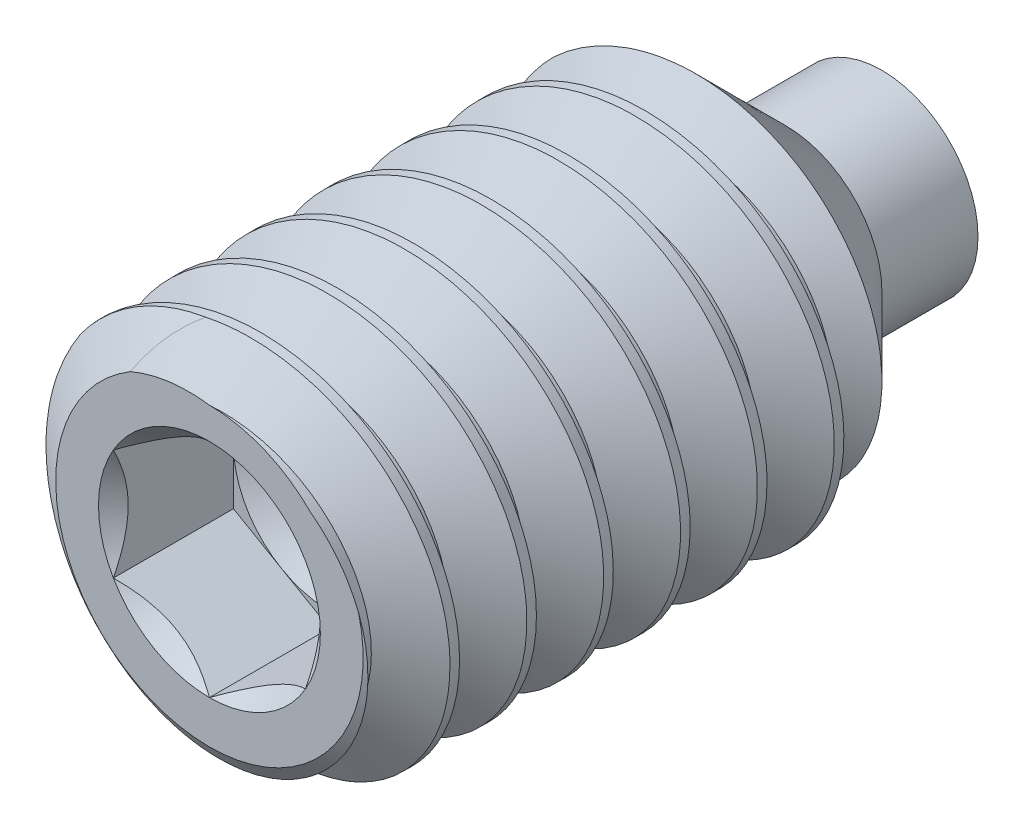
from build123d import *

# Parameters (mm, degrees)
CUT_SWEEP2_PITCH    = 1.27
CUT_EXTRUDE10_DEPTH = 1.984375


with BuildPart() as part:
    # Sketch22 → Revolve1 (revolve)
    with BuildSketch(Plane(origin=(0, 0, 0), x_dir=(0, 0, -1), z_dir=(1, 0, 0)), mode=Mode.PRIVATE) as revolve1_sk:
        Polygon((-5.55625, 0), (-5.55625, 2.54), (-5.111618213, 3.175), (2.38125, 3.175), (3.96875, 1.5875), (5.55625, 1.5875), (5.55625, 0), align=None)
    revolve(revolve1_sk.sketch.rotate(Axis((0, 0, -5.55625), (0, 0, 1)), 90), axis=Axis((0, 0, -5.55625), (0, 0, 1)))

    # Cut-Sweep2: the profile of Sketch28 profile screwed along a right-hand helix of 9.5 turns, 8 arcs to a turn; built about Z, then put on its axis
    cut_sweep2_z = Axis((0, 0, 0), (0, 0, 1))
    cut_sweep2_corners = [(3.1753, 0, 0.000173205), (3.1753, 0, -1.111423205), (2.350110803, 0, -0.635), (2.350110803, 0, -0.47625)]
    with BuildLine(mode=Mode.PRIVATE) as cut_sweep2_profile:
        Line(cut_sweep2_corners[0], cut_sweep2_corners[1])
        Line(cut_sweep2_corners[1], cut_sweep2_corners[2])
        Line(cut_sweep2_corners[2], cut_sweep2_corners[3])
        Line(cut_sweep2_corners[3], cut_sweep2_corners[0])
    cut_sweep2_cap = Face(cut_sweep2_profile.wire())
    cut_sweep2_turn_angles = [0, 22.5, 45, 67.5, 90, 112.5, 135, 157.5, 180, 202.5, 225, 247.5, 270, 292.5, 315, 337.5, 360]
    cut_sweep2_turn_weights = [1, 0.9238795325112867, 1, 0.9238795325112867, 1, 0.9238795325112867, 1, 0.9238795325112867, 1, 0.9238795325112867, 1, 0.9238795325112867, 1, 0.9238795325112867, 1, 0.9238795325112867, 1]
    cut_sweep2_turn_rails = [Edge.make_bspline([Vector(p[0], p[1], 0).rotate(cut_sweep2_z, cut_sweep2_turn_angles[k]) / cut_sweep2_turn_weights[k] + Vector(0, 0, p[2] + CUT_SWEEP2_PITCH * cut_sweep2_turn_angles[k] / 360) for k in range(17)], [0, 0, 0, 1, 1, 2, 2, 3, 3, 4, 4, 5, 5, 6, 6, 7, 7, 8, 8, 8], 2, cut_sweep2_turn_weights) for p in cut_sweep2_corners]
    cut_sweep2_turn_sides = [Face.make_surface_from_curves(cut_sweep2_turn_rails[p[0]], cut_sweep2_turn_rails[p[1]]) for p in [(0, 1), (1, 2), (2, 3), (3, 0)]]
    cut_sweep2_last_angles = [3240, 3262.5, 3285, 3307.5, 3330, 3352.5, 3375, 3397.5, 3420]
    cut_sweep2_last_weights = [1, 0.9238795325112867, 1, 0.9238795325112867, 1, 0.9238795325112867, 1, 0.9238795325112442, 1]
    cut_sweep2_last_rails = [Edge.make_bspline([Vector(p[0], p[1], 0).rotate(cut_sweep2_z, cut_sweep2_last_angles[k]) / cut_sweep2_last_weights[k] + Vector(0, 0, p[2] + CUT_SWEEP2_PITCH * cut_sweep2_last_angles[k] / 360) for k in range(9)], [0, 0, 0, 1, 1, 2, 2, 3, 3, 4, 4, 4], 2, cut_sweep2_last_weights) for p in cut_sweep2_corners]
    cut_sweep2_last_sides = [Face.make_surface_from_curves(cut_sweep2_last_rails[p[0]], cut_sweep2_last_rails[p[1]]) for p in [(0, 1), (1, 2), (2, 3), (3, 0)]]
    cut_sweep2 = Plane(origin=(0, 0, -3.96875), x_dir=(0, 1, 0), z_dir=(0, 0, 1)) * Solid(Shell([*[p.moved(Location((0, 0, CUT_SWEEP2_PITCH * i))) for i in range(9) for p in cut_sweep2_turn_sides], *cut_sweep2_last_sides, cut_sweep2_cap, cut_sweep2_cap.rotate(cut_sweep2_z, 3420).moved(Location((0, 0, CUT_SWEEP2_PITCH * 3420 / 360)))]))
    add(cut_sweep2, mode=Mode.SUBTRACT)

    # Sketch23 → Cut-Extrude10 (cut)
    with BuildSketch(Plane.XY.offset(5.55625)):
        Polygon((0, 1.833087105), (-1.5875, 0.916543552), (-1.5875, -0.916543552), (0, -1.833087105), (1.5875, -0.916543552), (1.5875, 0.916543552), align=None)
    extrude(amount=-CUT_EXTRUDE10_DEPTH, mode=Mode.SUBTRACT)

    # Cut-Extrude11 cone 1 section (through the dimple's axis) → Cut-Extrude11 (revolve, cut)
    with BuildSketch(Plane(origin=(0, 0, 5.55625), x_dir=(0, -1, 0), z_dir=(1, 0, 0))):
        Polygon((0, 0), (1.833087105, 0), (0, 1.833087105), align=None)
    revolve(axis=Axis((0, 0, 5.55625), (0, 0, -1)), mode=Mode.SUBTRACT)

    # Cut-Extrude12 cone 1 section (through the dimple's axis) → Cut-Extrude12 (revolve, cut)
    with BuildSketch(Plane(origin=(0, 0, 3.571875), x_dir=(0, -1, 0), z_dir=(1, 0, 0))):
        Polygon((0, 0), (1.5875, 0), (0, 0.916543552), align=None)
    revolve(axis=Axis((0, 0, 3.571875), (0, 0, -1)), mode=Mode.SUBTRACT)


solid = part.part
